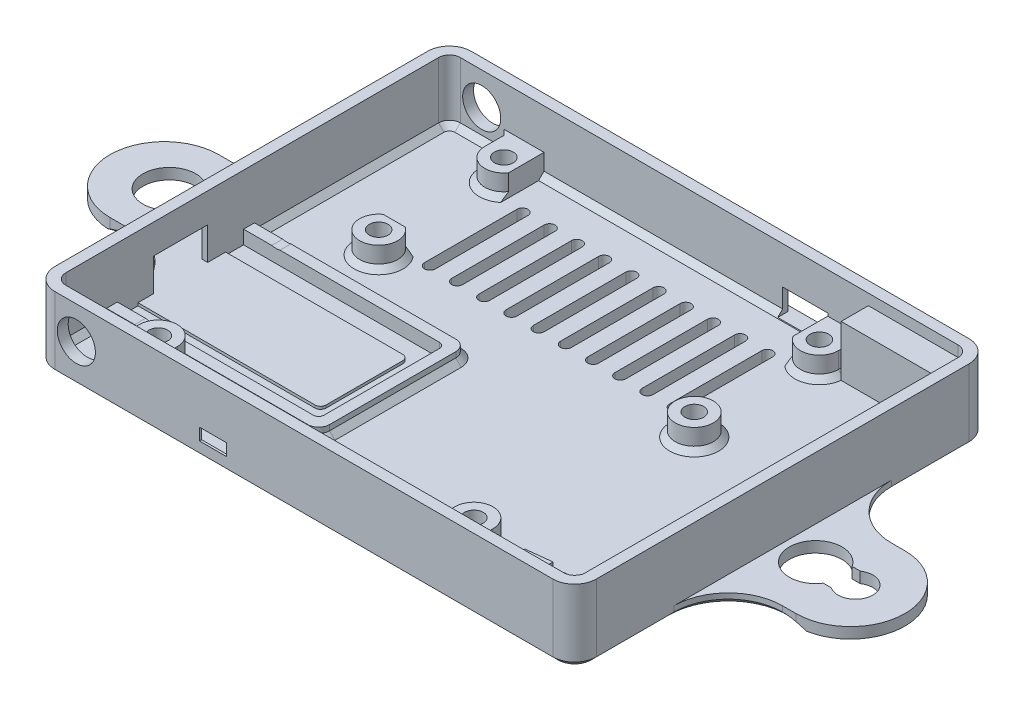
from build123d import *

# Parameters (mm, degrees)
BOSS_EXTRUDE1_DEPTH                               = 13.4
SKETCH23_W                                        = 25.165964968
SKETCH23_H                                        = 40
SKETCH23_W_2                                      = 26.273202002
CUT_EXTRUDE9_DEPTH                                = 11.4
BOSS_EXTRUDE2_DEPTH                               = 2
SKETCH4_R                                         = 3.5
BOSS_EXTRUDE3_DEPTH                               = 4
CSK_FOR_4_FLAT_HEAD_SOCKET_CAP_SCREW1_D           = 3.4544
CSK_FOR_4_FLAT_HEAD_SOCKET_CAP_SCREW1_CSINK_D     = 6.7237356
CSK_FOR_4_FLAT_HEAD_SOCKET_CAP_SCREW1_CSINK_ANGLE = 82
CUT_EXTRUDE1_REACH                                = 130.803
SKETCH7_W                                         = 8.3
SKETCH7_H                                         = 4.4
BOSS_EXTRUDE5_DEPTH                               = 2
FILLET1_R                                         = 1
FILLET2_R                                         = 1
FILLET3_R                                         = 2
CUT_EXTRUDE4_REACH                                = 136.745
SKETCH16_W                                        = 10
SKETCH16_H                                        = 6
BOSS_EXTRUDE4_DEPTH                               = 7.4
CSK_FOR_4_FLAT_HEAD_SOCKET_CAP_SCREW2_D           = 3.4544
CSK_FOR_4_FLAT_HEAD_SOCKET_CAP_SCREW2_CSINK_D     = 6.7237356
CSK_FOR_4_FLAT_HEAD_SOCKET_CAP_SCREW2_CSINK_ANGLE = 82
CHAMFER1_SIZE                                     = 1
CHAMFER2_SIZE                                     = 1
CHAMFER3_SIZE                                     = 1
CHAMFER4_SIZE                                     = 1
CUT_EXTRUDE2_REACH                                = 121.677
SKETCH14_R                                        = 3.5
CUT_EXTRUDE3_DEPTH                                = 129.80292872
BOSS_EXTRUDE6_DEPTH                               = 11.4
CUT_EXTRUDE5_START                                = -2
CUT_EXTRUDE5_DEPTH                                = 2
CUT_EXTRUDE6_DEPTH                                = 2
CUT_EXTRUDE6_DEPTH_BACK                           = 1.6
SKETCH19_W                                        = 11.8
SKETCH19_H                                        = 4
SKETCH20_W                                        = 5
SKETCH20_H                                        = 2.2
CUT_EXTRUDE7_DEPTH                                = 129.565759232
CUT_EXTRUDE8_DEPTH                                = 0.5
BOSS_EXTRUDE7_DEPTH                               = 2
SKETCH24_W                                        = 18.5
SKETCH24_H                                        = 9.4
BOSS_EXTRUDE8_DEPTH                               = 5


with BuildPart() as part:
    # Sketch2 → Boss-Extrude1 (new body)
    with BuildSketch(Plane(origin=(0, 0, 0), x_dir=(1, 0, 0), z_dir=(0, 1, 0))):
        with BuildLine():
            ThreePointArc((30.883018236, -31.622145181), (23.811950424, -34.551077369), (20.883018236, -41.622145181))
            Line((20.883018236, -41.622145181), (20.883018236, -55.872145181))
            ThreePointArc((20.883018236, -55.872145181), (19.711445361, -58.700572306), (16.883018236, -59.872145181))
            Line((16.883018236, -59.872145181), (-74.616981764, -59.872145181))
            ThreePointArc((-74.616981764, -59.872145181), (-77.445408889, -58.700572306), (-78.616981764, -55.872145181))
            Line((-78.616981764, -55.872145181), (-78.616981764, -41.622145181))
            ThreePointArc((-78.616981764, -41.622145181), (-81.545913952, -34.551077369), (-88.616981764, -31.622145181))
            Line((-88.616981764, -31.622145181), (-92.753999563, -31.622145181))
            ThreePointArc((-92.753999563, -31.622145181), (-102.753999563, -21.622145181), (-92.753999563, -11.622145181))
            Line((-92.753999563, -11.622145181), (-88.616981764, -11.622145181))
            ThreePointArc((-88.616981764, -11.622145181), (-81.545913952, -8.693212993), (-78.616981764, -1.622145181))
            Line((-78.616981764, -1.622145181), (-78.616981764, 12.627854819))
            ThreePointArc((-78.616981764, 12.627854819), (-77.445408889, 15.456281944), (-74.616981764, 16.627854819))
            Line((-74.616981764, 16.627854819), (16.883018236, 16.627854819))
            ThreePointArc((16.883018236, 16.627854819), (19.711445361, 15.456281944), (20.883018236, 12.627854819))
            Line((20.883018236, 12.627854819), (20.883018236, -1.622145181))
            ThreePointArc((20.883018236, -1.622145181), (23.811950424, -8.693212993), (30.883018236, -11.622145181))
            Line((30.883018236, -11.622145181), (33.349251591, -11.622145181))
            ThreePointArc((33.349251591, -11.622145181), (43.349251591, -21.622145181), (33.349251591, -31.622145181))
            Line((33.349251591, -31.622145181), (30.883018236, -31.622145181))
        make_face()
        with BuildLine():
            ThreePointArc((-87.799481249, -18.964457529), (-96.687349183, -21.622145181), (-87.799481249, -24.279832834))
            Line((-87.799481249, -24.279832834), (-86.319129664, -24.279832834))
            ThreePointArc((-86.319129664, -24.279832834), (-81.336800755, -21.622145181), (-86.319129664, -18.964457529))
            Line((-86.319129664, -18.964457529), (-87.799481249, -18.964457529))
        make_face(mode=Mode.SUBTRACT)
        with BuildLine():
            ThreePointArc((32.474863499, -24.279832834), (37.457192409, -21.622145181), (32.474863499, -18.964457529))
            Line((32.474863499, -18.964457529), (30.994511914, -18.964457529))
            ThreePointArc((30.994511914, -18.964457529), (22.10664398, -21.622145181), (30.994511914, -24.279832834))
            Line((30.994511914, -24.279832834), (32.474863499, -24.279832834))
        make_face(mode=Mode.SUBTRACT)
        with BuildLine():
            ThreePointArc((-74.616981764, 14.627854819), (-76.031195326, 14.042068381), (-76.616981764, 12.627854819))
            Line((-76.616981764, 12.627854819), (-76.616981764, -55.872145181))
            ThreePointArc((-76.616981764, -55.872145181), (-76.031195326, -57.286358744), (-74.616981764, -57.872145181))
            Line((-74.616981764, -57.872145181), (16.883018236, -57.872145181))
            ThreePointArc((16.883018236, -57.872145181), (18.297231798, -57.286358744), (18.883018236, -55.872145181))
            Line((18.883018236, -55.872145181), (18.883018236, 12.627854819))
            ThreePointArc((18.883018236, 12.627854819), (18.297231798, 14.042068381), (16.883018236, 14.627854819))
            Line((16.883018236, 14.627854819), (-74.616981764, 14.627854819))
        make_face(mode=Mode.SUBTRACT)
    extrude(amount=BOSS_EXTRUDE1_DEPTH)

    # Sketch23 → Cut-Extrude9 (cut)
    with BuildSketch(Plane(origin=(0, 13.4, 0), x_dir=(1, 0, 0), z_dir=(0, 1, 0))):
        with Locations((-91.199964248, -21.622145181)):
            Rectangle(SKETCH23_W, SKETCH23_H)
        with Locations((34.019619237, -21.622145181)):
            Rectangle(SKETCH23_W_2, SKETCH23_H)
    extrude(amount=-CUT_EXTRUDE9_DEPTH, mode=Mode.SUBTRACT)

    # Sketch2<3> → Boss-Extrude2 (add)
    with BuildSketch(Plane(origin=(0, 0, 0), x_dir=(1, 0, 0), z_dir=(0, 1, 0))):
        with BuildLine():
            Line((-74.616981764, 14.627854819), (16.883018236, 14.627854819))
            ThreePointArc((16.883018236, 14.627854819), (18.297231798, 14.042068381), (18.883018236, 12.627854819))
            Line((18.883018236, 12.627854819), (18.883018236, -55.872145181))
            ThreePointArc((18.883018236, -55.872145181), (18.297231798, -57.286358744), (16.883018236, -57.872145181))
            Line((16.883018236, -57.872145181), (-74.616981764, -57.872145181))
            ThreePointArc((-74.616981764, -57.872145181), (-76.031195326, -57.286358744), (-76.616981764, -55.872145181))
            Line((-76.616981764, -55.872145181), (-76.616981764, 12.627854819))
            ThreePointArc((-76.616981764, 12.627854819), (-76.031195326, 14.042068381), (-74.616981764, 14.627854819))
        make_face()
    extrude(amount=BOSS_EXTRUDE2_DEPTH)

    # Sketch4 → Boss-Extrude3 (add)
    with BuildSketch(Plane(origin=(0, 2, 0), x_dir=(1, 0, 0), z_dir=(0, 1, 0))):
        with Locations(Location((-4.116981764, -12.872145181, 0), (0, 0, 270))):
            Circle(SKETCH4_R)
        with BuildLine():
            Line((-59.234341769, 14.627854819), (-59.234341769, 8.142814098))
            ThreePointArc((-59.234341769, 8.142814098), (-63.156395065, 6.785756677), (-65.616981764, 10.127854819))
            Line((-65.616981764, 10.127854819), (-65.616981764, 14.627854819))
            Line((-65.616981764, 14.627854819), (-59.234341769, 14.627854819))
        make_face()
        with BuildLine():
            Line((-7.082532008, 14.627854819), (-0.616981764, 14.627854819))
            Line((-0.616981764, 14.627854819), (-0.616981764, 10.127854819))
            ThreePointArc((-0.616981764, 10.127854819), (-3.149879354, 6.764119852), (-7.082532008, 8.268954136))
            Line((-7.082532008, 8.268954136), (-7.082532008, 14.627854819))
        make_face()
        with BuildLine():
            Line((-64.139653984, -10.015784368), (-60.094309544, -10.015784368))
            ThreePointArc((-60.094309544, -10.015784368), (-62.116981764, -16.372145181), (-64.139653984, -10.015784368))
        make_face()
    extrude(amount=BOSS_EXTRUDE3_DEPTH)

    # CSK for #4 Flat Head Socket Cap Screw1 (through all)
    with Locations(Plane(origin=(0, 0, 0), x_dir=(-1, 0, 0), z_dir=(0, -1, 0))):
        with Locations((4.116981764, 10.127854819), (62.116981764, 10.127854819), (4.116981764, -12.872145181), (62.116981764, -12.872145181)):
            CounterSinkHole(CSK_FOR_4_FLAT_HEAD_SOCKET_CAP_SCREW1_D / 2, CSK_FOR_4_FLAT_HEAD_SOCKET_CAP_SCREW1_CSINK_D / 2, counter_sink_angle=CSK_FOR_4_FLAT_HEAD_SOCKET_CAP_SCREW1_CSINK_ANGLE)

    # Sketch7 → Cut-Extrude1 (cut, up to next)
    with BuildSketch(Plane(origin=(0, 0, -16.627854819), x_dir=(-1, 0, 0), z_dir=(0, 0, -1)), mode=Mode.PRIVATE) as cut_extrude1_sk1:
        with Locations((11.232532008, 4.3)):
            Rectangle(SKETCH7_W, SKETCH7_H)
    cut_extrude1_tool1 = extrude(cut_extrude1_sk1.sketch, amount=-CUT_EXTRUDE1_REACH, mode=Mode.PRIVATE) & part.part
    add(cut_extrude1_tool1.solids().sort_by_distance((-11.232532, 4.3, -16.627855))[0], mode=Mode.SUBTRACT)

    # Sketch15 → Boss-Extrude5 (add)
    with BuildSketch(Plane(origin=(0, 2, 0), x_dir=(1, 0, 0), z_dir=(0, 1, 0))):
        Polygon((-76.616981764, -23.205263249), (-39.616981764, -23.205263249), (-39.616981764, -46.405263249), (-76.616981764, -46.405263249), (-76.616981764, -48.405263249), (-37.616981764, -48.405263249), (-37.616981764, -21.205263249), (-76.616981764, -21.205263249), align=None)
    extrude(amount=BOSS_EXTRUDE5_DEPTH)

    # Fillet1
    fillet1_edges = [part.edges().sort_by_distance(p)[0] for p in [
        (-39.616981764, 3, 23.205263249),
    ]]
    fillet(fillet1_edges, radius=FILLET1_R)

    # Fillet2
    fillet2_edges = [part.edges().sort_by_distance(p)[0] for p in [
        (-39.616981764, 3, 46.405263249),
    ]]
    fillet(fillet2_edges, radius=FILLET2_R)

    # Fillet3
    fillet3_edges = [part.edges().sort_by_distance(p)[0] for p in [
        (-37.616981764, 3, 48.405263249),
        (-37.616981764, 3, 21.205263249),
    ]]
    fillet(fillet3_edges, radius=FILLET3_R)

    # Sketch16 → Cut-Extrude4 (cut, up to next)
    with BuildSketch(Plane(origin=(-76.616981764, 0, 0), x_dir=(0, 0, -1), z_dir=(1, 0, 0)), mode=Mode.PRIVATE) as cut_extrude4_sk1:
        with Locations((-34.805263249, 5)):
            Rectangle(SKETCH16_W, SKETCH16_H)
    cut_extrude4_tool1 = extrude(cut_extrude4_sk1.sketch, amount=-CUT_EXTRUDE4_REACH, mode=Mode.PRIVATE) & part.part
    add(cut_extrude4_tool1.solids().sort_by_distance((-76.616982, 5, 34.805263))[0], mode=Mode.SUBTRACT)

    # Sketch9 → Boss-Extrude4 (add)
    with BuildSketch(Plane(origin=(0, 2, 0), x_dir=(1, 0, 0), z_dir=(0, 1, 0))):
        with BuildLine():
            Line((-65.616981764, -57.872145181), (-58.616981764, -57.872145181))
            Line((-58.616981764, -57.872145181), (-58.616981764, -53.372145181))
            ThreePointArc((-58.616981764, -53.372145181), (-62.116981764, -49.872145181), (-65.616981764, -53.372145181))
            Line((-65.616981764, -53.372145181), (-65.616981764, -57.872145181))
        make_face()
        with BuildLine():
            Line((-7.616981764, -53.372145181), (-7.616981764, -57.872145181))
            Line((-7.616981764, -57.872145181), (-0.616981764, -57.872145181))
            Line((-0.616981764, -57.872145181), (-0.616981764, -53.372145181))
            ThreePointArc((-0.616981764, -53.372145181), (-4.116981764, -49.872145181), (-7.616981764, -53.372145181))
        make_face()
    extrude(amount=BOSS_EXTRUDE4_DEPTH)

    # CSK for #4 Flat Head Socket Cap Screw2 (through all)
    with Locations(Plane(origin=(0, 0, 0), x_dir=(-1, 0, 0), z_dir=(0, -1, 0))):
        with Locations((4.116981764, -53.372145181), (62.116981764, -53.372145181)):
            CounterSinkHole(CSK_FOR_4_FLAT_HEAD_SOCKET_CAP_SCREW2_D / 2, CSK_FOR_4_FLAT_HEAD_SOCKET_CAP_SCREW2_CSINK_D / 2, counter_sink_angle=CSK_FOR_4_FLAT_HEAD_SOCKET_CAP_SCREW2_CSINK_ANGLE)

    # Chamfer1
    chamfer1_edges = [part.edges().sort_by_distance(p)[0] for p in [
        (-0.616981764, 4, -14.627854819),
        (-65.616981764, 4, -14.627854819),
        (-7.616981764, 5.7, 57.872145181),
        (-0.616981764, 5.7, 57.872145181),
        (-65.616981764, 5.7, 57.872145181),
        (-58.616981764, 5.7, 57.872145181),
    ]]
    chamfer(chamfer1_edges, length=CHAMFER1_SIZE)

    # Chamfer2
    # the kernel refuses this chamfer: 1 mm, written as the material it adds along each edge
    with BuildSketch(Plane(origin=(-62.116981764, 2, 12.872145181), x_dir=(0.003141587485879022, 0, -0.9999950652018582), z_dir=(-0.9999950652018582, 0, -0.003141587485879022))) as chamfer2_piece_1_section:
        Polygon((3.5, -CHAMFER2_SIZE), (3.5 + CHAMFER2_SIZE, 0), (3.5, 0), align=None)
    chamfer2_piece_1 = revolve(axis=Axis((-62.116981764, 2, 12.872145181), (0, -1, 0)), revolution_arc=359.64, mode=Mode.PRIVATE)
    chamfer2_piece_1 = split(chamfer2_piece_1, bisect_by=Plane(origin=(-62.116981764, 2, 10.015784368), z_dir=(0, 0, 1)), keep=Keep.TOP, mode=Mode.PRIVATE)
    add(chamfer2_piece_1)
    with BuildSketch(Plane(origin=(-65.616981764, 2, -10.127854819), x_dir=(-1, 0, 0), z_dir=(0, 0, -1)), Plane(origin=(-0.616981764, 2, -16.199537807), x_dir=(1, 0, 0), z_dir=(0, 0, 1))) as chamfer2_piece_2:
        Polygon((CHAMFER2_SIZE, 0), (0, CHAMFER2_SIZE), (0, 0), align=None)
    extrude(amount=6.071682988)
    with BuildSketch(Plane(origin=(-62.116981764, 2, -10.127854819), x_dir=(0.9912359001966069, 0, -0.13210370987001943), z_dir=(-0.13210370987001943, 0, -0.9912359001966069))) as chamfer2_piece_3_section:
        Polygon((3.5 + CHAMFER2_SIZE, 0), (3.5, -CHAMFER2_SIZE), (3.5, 0), align=None)
    chamfer2_piece_3 = revolve(axis=Axis((-62.116981764, 2, -10.127854819), (0, -1, 0)), revolution_arc=187.591174622, mode=Mode.PRIVATE)
    chamfer2_piece_3 = split(chamfer2_piece_3, bisect_by=Plane(origin=(-59.234341769, 2, -10.127854819), z_dir=(-1, 0, 0)), keep=Keep.TOP, mode=Mode.PRIVATE)
    add(chamfer2_piece_3)
    with BuildSketch(Plane(origin=(18.883018236, 2, -12.627854819), x_dir=(-1, 0, 0), z_dir=(0, 0, 1))) as chamfer2_piece_4:
        Polygon((CHAMFER2_SIZE, 0), (0, -CHAMFER2_SIZE), (0, 0), align=None)
    extrude(amount=68.5)
    with BuildSketch(Plane(origin=(-74.616981764, 2, -14.627854819), x_dir=(0, 0, 1), z_dir=(1, 0, 0)), Plane(origin=(-64.045298776, 2, 57.872145181), x_dir=(0, 0, -1), z_dir=(-1, 0, 0))) as chamfer2_piece_5:
        Polygon((CHAMFER2_SIZE, 0), (0, -CHAMFER2_SIZE), (0, 0), align=None)
    extrude(amount=10.571682988)
    with BuildSketch(Plane(origin=(-74.616981764, 2, -12.627854819), x_dir=(-1, 0, 0), z_dir=(0, 0, 1))) as chamfer2_piece_6:
        Polygon((2 - CHAMFER2_SIZE, 0), (2, -CHAMFER2_SIZE), (2, 0), align=None)
    revolve(axis=Axis((-74.616981764, 2, -12.627854819), (0, -1, 0)), revolution_arc=90)
    with BuildSketch(Plane(origin=(-76.616981764, 2, 23.776946237), x_dir=(1, 0, 0), z_dir=(0, 0, -1))) as chamfer2_piece_7_section:
        Polygon((CHAMFER2_SIZE, 0), (0, -CHAMFER2_SIZE), (0, 0), align=None)
    chamfer2_piece_7 = extrude(amount=36.404801056, mode=Mode.PRIVATE)
    chamfer2_piece_7 = split(chamfer2_piece_7, bisect_by=Plane(origin=(-76.616981764, 2, 23.205263249), z_dir=(0, 0, -1)), keep=Keep.TOP, mode=Mode.PRIVATE)
    add(chamfer2_piece_7)
    with BuildSketch(Plane(origin=(-61.806024757, 2, -14.627854819), x_dir=(0, 0, 1), z_dir=(1, 0, 0))) as chamfer2_piece_8_section:
        Polygon((CHAMFER2_SIZE, 0), (0, -CHAMFER2_SIZE), (0, 0), align=None)
    chamfer2_piece_8 = extrude(amount=57.295175737, mode=Mode.PRIVATE)
    chamfer2_piece_8 = split(chamfer2_piece_8, bisect_by=Plane(origin=(-61.806024757, 2.1, -14.627854819), z_dir=(0, -1, 0)), keep=Keep.TOP, mode=Mode.PRIVATE)
    add(chamfer2_piece_8)
    with BuildSketch(Plane(origin=(-61.806024757, 2, -14.627854819), x_dir=(0, 0, 1), z_dir=(1, 0, 0))) as chamfer2_piece_9_section:
        Polygon((CHAMFER2_SIZE, 0), (0, -CHAMFER2_SIZE), (0, 0), align=None)
    chamfer2_piece_9 = extrude(amount=57.295175737, mode=Mode.PRIVATE)
    chamfer2_piece_9 = split(chamfer2_piece_9, bisect_by=Plane(origin=(-15.382532008, 2, -14.627854819), z_dir=(-1, 0, 0)), keep=Keep.TOP, mode=Mode.PRIVATE)
    add(chamfer2_piece_9)
    with BuildSketch(Plane(origin=(-74.616981764, 2, 55.872145181), x_dir=(0, 0, 1), z_dir=(1, 0, 0))) as chamfer2_piece_10:
        Polygon((2 - CHAMFER2_SIZE, 0), (2, -CHAMFER2_SIZE), (2, 0), align=None)
    revolve(axis=Axis((-74.616981764, 2, 55.872145181), (0, -1, 0)), revolution_arc=90)
    with BuildSketch(Plane(origin=(-65.616981764, 2, 53.372145181), x_dir=(-1, 0, 0), z_dir=(0, 0, 1)), Plane(origin=(-58.616981764, 2, 59.443828169), x_dir=(1, 0, 0), z_dir=(0, 0, -1)), Plane(origin=(-0.616981764, 2, 59.443828169), x_dir=(1, 0, 0), z_dir=(0, 0, -1)), Plane(origin=(-7.616981764, 2, 53.372145181), x_dir=(-1, 0, 0), z_dir=(0, 0, 1))) as chamfer2_piece_11:
        Polygon((CHAMFER2_SIZE, 0), (0, -CHAMFER2_SIZE), (0, 0), align=None)
    extrude(amount=6.071682988)
    with BuildSketch(Plane(origin=(-62.116981764, 2, 53.372145181), x_dir=(1, 0, 0), z_dir=(0, 0, 1))) as chamfer2_piece_12:
        Polygon((3.5 + CHAMFER2_SIZE, 0), (3.5, CHAMFER2_SIZE), (3.5, 0), align=None)
    revolve(axis=Axis((-62.116981764, 2, 53.372145181), (0, 1, 0)), revolution_arc=180)
    with BuildSketch(Plane(origin=(16.883018236, 2, 57.872145181), x_dir=(0, 0, -1), z_dir=(-1, 0, 0)), Plane(origin=(-2.188664752, 2, -14.627854819), x_dir=(0, 0, 1), z_dir=(1, 0, 0))) as chamfer2_piece_13:
        Polygon((CHAMFER2_SIZE, 0), (0, -CHAMFER2_SIZE), (0, 0), align=None)
    extrude(amount=19.071682988)
    with BuildSketch(Plane(origin=(16.883018236, 2, 55.872145181), x_dir=(1, 0, 0), z_dir=(0, 0, -1))) as chamfer2_piece_14:
        Polygon((2 - CHAMFER2_SIZE, 0), (2, -CHAMFER2_SIZE), (2, 0), align=None)
    revolve(axis=Axis((16.883018236, 2, 55.872145181), (0, -1, 0)), revolution_arc=90)
    with BuildSketch(Plane(origin=(-6.045298776, 2, 57.872145181), x_dir=(0, 0, -1), z_dir=(-1, 0, 0))) as chamfer2_piece_15:
        Polygon((CHAMFER2_SIZE, 0), (0, -CHAMFER2_SIZE), (0, 0), align=None)
    extrude(amount=54.143365976)
    with BuildSketch(Plane(origin=(16.883018236, 2, -12.627854819), x_dir=(0, 0, -1), z_dir=(-1, 0, 0))) as chamfer2_piece_16:
        Polygon((2 - CHAMFER2_SIZE, 0), (2, -CHAMFER2_SIZE), (2, 0), align=None)
    revolve(axis=Axis((16.883018236, 2, -12.627854819), (0, -1, 0)), revolution_arc=90)
    with BuildSketch(Plane(origin=(-4.116981764, 2, -10.127854819), x_dir=(1, 0, 0), z_dir=(0, 0, -1))) as chamfer2_piece_17_section:
        Polygon((3.5 + CHAMFER2_SIZE, 0), (3.5, -CHAMFER2_SIZE), (3.5, 0), align=None)
    chamfer2_piece_17 = revolve(axis=Axis((-4.116981764, 2, -10.127854819), (0, -1, 0)), revolution_arc=190.063940547, mode=Mode.PRIVATE)
    chamfer2_piece_17 = split(chamfer2_piece_17, bisect_by=Plane(origin=(-7.082532008, 2, -10.127854819), z_dir=(1, 0, 0)), keep=Keep.TOP, mode=Mode.PRIVATE)
    add(chamfer2_piece_17)
    with BuildSketch(Plane(origin=(-4.116981764, 2, 53.372145181), x_dir=(1, 0, 0), z_dir=(0, 0, 1))) as chamfer2_piece_18:
        Polygon((3.5 + CHAMFER2_SIZE, 0), (3.5, CHAMFER2_SIZE), (3.5, 0), align=None)
    revolve(axis=Axis((-4.116981764, 2, 53.372145181), (0, 1, 0)), revolution_arc=180)
    with BuildSketch(Plane(origin=(-4.116981764, 2, 12.872145181), x_dir=(0, 0, 1), z_dir=(-1, 0, 0))) as chamfer2_piece_19:
        Polygon((3.5 + CHAMFER2_SIZE, 0), (3.5, CHAMFER2_SIZE), (3.5, 0), align=None)
    revolve(axis=Axis((-4.116981764, 2, 12.872145181), (0, 1, 0)))
    with BuildSketch(Plane(origin=(-79.188664752, 2, 48.405263249), x_dir=(0, 0, 1), z_dir=(1, 0, 0))) as chamfer2_piece_20_section:
        Polygon((CHAMFER2_SIZE, 0), (0, -CHAMFER2_SIZE), (0, 0), align=None)
    chamfer2_piece_20 = extrude(amount=39.571682988, mode=Mode.PRIVATE)
    chamfer2_piece_20 = split(chamfer2_piece_20, bisect_by=Plane(origin=(-78.616981764, 2, 48.405263249), z_dir=(1, 0, 0)), keep=Keep.TOP, mode=Mode.PRIVATE)
    add(chamfer2_piece_20)
    with BuildSketch(Plane(origin=(-39.616981764, 2, 21.205263249), x_dir=(0, 0, -1), z_dir=(-1, 0, 0))) as chamfer2_piece_21_section:
        Polygon((CHAMFER2_SIZE, 0), (0, -CHAMFER2_SIZE), (0, 0), align=None)
    chamfer2_piece_21 = extrude(amount=39.571682988, mode=Mode.PRIVATE)
    chamfer2_piece_21 = split(chamfer2_piece_21, bisect_by=Plane(origin=(-78.616981764, 2, 21.205263249), z_dir=(1, 0, 0)), keep=Keep.TOP, mode=Mode.PRIVATE)
    add(chamfer2_piece_21)
    with BuildSketch(Plane(origin=(-39.616981764, 2, 46.405263249), x_dir=(0, 0, 1), z_dir=(-1, 0, 0))) as chamfer2_piece_22:
        Polygon((2 + CHAMFER2_SIZE, 0), (2, CHAMFER2_SIZE), (2, 0), align=None)
    revolve(axis=Axis((-39.616981764, 2, 46.405263249), (0, 1, 0)), revolution_arc=90)
    with BuildSketch(Plane(origin=(-39.616981764, 2, 23.205263249), x_dir=(0, 0, -1), z_dir=(-1, 0, 0))) as chamfer2_piece_23:
        Polygon((2 + CHAMFER2_SIZE, 0), (2, -CHAMFER2_SIZE), (2, 0), align=None)
    revolve(axis=Axis((-39.616981764, 2, 23.205263249), (0, -1, 0)), revolution_arc=90)
    with BuildSketch(Plane(origin=(-37.616981764, 2, 46.405263249), x_dir=(1, 0, 0), z_dir=(0, 0, -1))) as chamfer2_piece_24:
        Polygon((CHAMFER2_SIZE, 0), (0, -CHAMFER2_SIZE), (0, 0), align=None)
    extrude(amount=23.2)
    with BuildSketch(Plane(origin=(-76.616981764, 2, 55.872145181), x_dir=(1, 0, 0), z_dir=(0, 0, -1))) as chamfer2_piece_25:
        Polygon((CHAMFER2_SIZE, 0), (0, -CHAMFER2_SIZE), (0, 0), align=None)
    extrude(amount=7.466881932)

    # Chamfer3
    # the kernel refuses this chamfer: 1 mm, written as the material it takes off along each edge
    with BuildSketch(Plane(origin=(20.883018236, 0, 41.622145181), x_dir=(0, 1, 0), z_dir=(0, 0, 1)), Plane(origin=(-78.616981764, 0, 55.872145181), x_dir=(0, 1, 0), z_dir=(0, 0, -1)), Plane(origin=(-78.616981764, 0, 1.622145181), x_dir=(0, 1, 0), z_dir=(0, 0, -1)), Plane(origin=(20.883018236, 0, -12.627854819), x_dir=(0, 1, 0), z_dir=(0, 0, 1))) as chamfer3_piece_1:
        Polygon((CHAMFER3_SIZE, 0), (0, CHAMFER3_SIZE), (0, 0), align=None)
    extrude(amount=14.25, mode=Mode.SUBTRACT)
    with BuildSketch(Plane(origin=(16.883018236, 0, 55.872145181), x_dir=(1, 0, 0), z_dir=(0, 0, -1))) as chamfer3_piece_2:
        Polygon((4, -CHAMFER3_SIZE), (4 - CHAMFER3_SIZE, 0), (4, 0), align=None)
    revolve(axis=Axis((16.883018236, 0, 55.872145181), (0, -1, 0)), revolution_arc=90, mode=Mode.SUBTRACT)
    with BuildSketch(Plane(origin=(16.883018236, 0, 59.872145181), x_dir=(0, 1, 0), z_dir=(-1, 0, 0)), Plane(origin=(-74.616981764, 0, -16.627854819), x_dir=(0, 1, 0), z_dir=(1, 0, 0))) as chamfer3_piece_3:
        Polygon((CHAMFER3_SIZE, 0), (0, CHAMFER3_SIZE), (0, 0), align=None)
    extrude(amount=91.5, mode=Mode.SUBTRACT)
    with BuildSketch(Plane(origin=(-74.616981764, 0, 55.872145181), x_dir=(0, 0, 1), z_dir=(1, 0, 0))) as chamfer3_piece_4:
        Polygon((4, -CHAMFER3_SIZE), (4 - CHAMFER3_SIZE, 0), (4, 0), align=None)
    revolve(axis=Axis((-74.616981764, 0, 55.872145181), (0, -1, 0)), revolution_arc=90, mode=Mode.SUBTRACT)
    with BuildSketch(Plane(origin=(-88.616981764, 0, 41.622145181), x_dir=(1, 0, 0), z_dir=(0, 0, 1))) as chamfer3_piece_5:
        Polygon((10, CHAMFER3_SIZE), (10 + CHAMFER3_SIZE, 0), (10, 0), align=None)
    revolve(axis=Axis((-88.616981764, 0, 41.622145181), (0, 1, 0)), revolution_arc=115.058981203, mode=Mode.SUBTRACT)
    with BuildSketch(Plane(origin=(-88.616981764, 0, 1.622145181), x_dir=(-0.42355100555257846, 0, 0.9058722568306193), z_dir=(-0.9058722568306193, 0, -0.42355100555257846))) as chamfer3_piece_6:
        Polygon((10, CHAMFER3_SIZE), (10 + CHAMFER3_SIZE, 0), (10, 0), align=None)
    revolve(axis=Axis((-88.616981764, 0, 1.622145181), (0, 1, 0)), revolution_arc=115.058981203, mode=Mode.SUBTRACT)
    with BuildSketch(Plane(origin=(-74.616981764, 0, -12.627854819), x_dir=(-1, 0, 0), z_dir=(0, 0, 1))) as chamfer3_piece_7:
        Polygon((4, -CHAMFER3_SIZE), (4 - CHAMFER3_SIZE, 0), (4, 0), align=None)
    revolve(axis=Axis((-74.616981764, 0, -12.627854819), (0, -1, 0)), revolution_arc=90, mode=Mode.SUBTRACT)
    with BuildSketch(Plane(origin=(16.883018236, 0, -12.627854819), x_dir=(0, 0, -1), z_dir=(-1, 0, 0))) as chamfer3_piece_8:
        Polygon((4, -CHAMFER3_SIZE), (4 - CHAMFER3_SIZE, 0), (4, 0), align=None)
    revolve(axis=Axis((16.883018236, 0, -12.627854819), (0, -1, 0)), revolution_arc=90, mode=Mode.SUBTRACT)
    with BuildSketch(Plane(origin=(30.883018236, 0, 1.622145181), x_dir=(-1, 0, 0), z_dir=(0, 0, -1))) as chamfer3_piece_9:
        Polygon((10, CHAMFER3_SIZE), (10 + CHAMFER3_SIZE, 0), (10, 0), align=None)
    revolve(axis=Axis((30.883018236, 0, 1.622145181), (0, 1, 0)), revolution_arc=115.058981203, mode=Mode.SUBTRACT)
    with BuildSketch(Plane(origin=(30.883018236, 0, 41.622145181), x_dir=(0.42355100555257597, 0, -0.9058722568306204), z_dir=(0.9058722568306204, 0, 0.42355100555257597))) as chamfer3_piece_10:
        Polygon((10, CHAMFER3_SIZE), (10 + CHAMFER3_SIZE, 0), (10, 0), align=None)
    revolve(axis=Axis((30.883018236, 0, 41.622145181), (0, 1, 0)), revolution_arc=115.058981203, mode=Mode.SUBTRACT)

    # Chamfer4
    chamfer4_edges = [part.edges().sort_by_distance(p)[0] for p in [
        (-7.082532008, 4.3, -16.627854819),
        (-15.382532008, 4.3, -16.627854819),
        (-78.616981764, 5, 39.805263249),
        (-78.616981764, 5, 29.805263249),
    ]]
    chamfer(chamfer4_edges, length=CHAMFER4_SIZE)

    # Sketch12 → Cut-Extrude2 (cut, up to next)
    with BuildSketch(Plane.XZ, mode=Mode.PRIVATE) as cut_extrude2_sk1:
        with BuildLine():
            Line((-54.660539895, 9.911346827), (-54.660539895, -7.088653173))
            ThreePointArc((-54.660539895, -7.088653173), (-55.660539895, -8.088653173), (-56.660539895, -7.088653173))
            Line((-56.660539895, -7.088653173), (-56.660539895, 9.911346827))
            ThreePointArc((-56.660539895, 9.911346827), (-55.660539895, 10.911346827), (-54.660539895, 9.911346827))
        make_face()
    cut_extrude2_tool1 = extrude(cut_extrude2_sk1.sketch, amount=-CUT_EXTRUDE2_REACH, mode=Mode.PRIVATE) & part.part
    # Sketch12 → Cut-Extrude2 (cut, up to next)
    with BuildSketch(Plane.XZ, mode=Mode.PRIVATE) as cut_extrude2_sk2:
        with BuildLine():
            Line((-49.660539895, 9.911346827), (-49.660539895, -7.088653173))
            ThreePointArc((-49.660539895, -7.088653173), (-50.660539895, -8.088653173), (-51.660539895, -7.088653173))
            Line((-51.660539895, -7.088653173), (-51.660539895, 9.911346827))
            ThreePointArc((-51.660539895, 9.911346827), (-50.660539895, 10.911346827), (-49.660539895, 9.911346827))
        make_face()
    cut_extrude2_tool2 = extrude(cut_extrude2_sk2.sketch, amount=-CUT_EXTRUDE2_REACH, mode=Mode.PRIVATE) & part.part
    # Sketch12 → Cut-Extrude2 (cut, up to next)
    with BuildSketch(Plane.XZ, mode=Mode.PRIVATE) as cut_extrude2_sk3:
        with BuildLine():
            Line((-44.660539895, 9.911346827), (-44.660539895, -7.088653173))
            ThreePointArc((-44.660539895, -7.088653173), (-45.660539895, -8.088653173), (-46.660539895, -7.088653173))
            Line((-46.660539895, -7.088653173), (-46.660539895, 9.911346827))
            ThreePointArc((-46.660539895, 9.911346827), (-45.660539895, 10.911346827), (-44.660539895, 9.911346827))
        make_face()
    cut_extrude2_tool3 = extrude(cut_extrude2_sk3.sketch, amount=-CUT_EXTRUDE2_REACH, mode=Mode.PRIVATE) & part.part
    # Sketch12 → Cut-Extrude2 (cut, up to next)
    with BuildSketch(Plane.XZ, mode=Mode.PRIVATE) as cut_extrude2_sk4:
        with BuildLine():
            Line((-39.660539895, 9.911346827), (-39.660539895, -7.088653173))
            ThreePointArc((-39.660539895, -7.088653173), (-40.660539895, -8.088653173), (-41.660539895, -7.088653173))
            Line((-41.660539895, -7.088653173), (-41.660539895, 9.911346827))
            ThreePointArc((-41.660539895, 9.911346827), (-40.660539895, 10.911346827), (-39.660539895, 9.911346827))
        make_face()
    cut_extrude2_tool4 = extrude(cut_extrude2_sk4.sketch, amount=-CUT_EXTRUDE2_REACH, mode=Mode.PRIVATE) & part.part
    # Sketch12 → Cut-Extrude2 (cut, up to next)
    with BuildSketch(Plane.XZ, mode=Mode.PRIVATE) as cut_extrude2_sk5:
        with BuildLine():
            Line((-34.660539895, 9.911346827), (-34.660539895, -7.088653173))
            ThreePointArc((-34.660539895, -7.088653173), (-35.660539895, -8.088653173), (-36.660539895, -7.088653173))
            Line((-36.660539895, -7.088653173), (-36.660539895, 9.911346827))
            ThreePointArc((-36.660539895, 9.911346827), (-35.660539895, 10.911346827), (-34.660539895, 9.911346827))
        make_face()
    cut_extrude2_tool5 = extrude(cut_extrude2_sk5.sketch, amount=-CUT_EXTRUDE2_REACH, mode=Mode.PRIVATE) & part.part
    # Sketch12 → Cut-Extrude2 (cut, up to next)
    with BuildSketch(Plane.XZ, mode=Mode.PRIVATE) as cut_extrude2_sk6:
        with BuildLine():
            Line((-29.660539895, 9.911346827), (-29.660539895, -7.088653173))
            ThreePointArc((-29.660539895, -7.088653173), (-30.660539895, -8.088653173), (-31.660539895, -7.088653173))
            Line((-31.660539895, -7.088653173), (-31.660539895, 9.911346827))
            ThreePointArc((-31.660539895, 9.911346827), (-30.660539895, 10.911346827), (-29.660539895, 9.911346827))
        make_face()
    cut_extrude2_tool6 = extrude(cut_extrude2_sk6.sketch, amount=-CUT_EXTRUDE2_REACH, mode=Mode.PRIVATE) & part.part
    # Sketch12 → Cut-Extrude2 (cut, up to next)
    with BuildSketch(Plane.XZ, mode=Mode.PRIVATE) as cut_extrude2_sk7:
        with BuildLine():
            Line((-24.660539895, 9.911346827), (-24.660539895, -7.088653173))
            ThreePointArc((-24.660539895, -7.088653173), (-25.660539895, -8.088653173), (-26.660539895, -7.088653173))
            Line((-26.660539895, -7.088653173), (-26.660539895, 9.911346827))
            ThreePointArc((-26.660539895, 9.911346827), (-25.660539895, 10.911346827), (-24.660539895, 9.911346827))
        make_face()
    cut_extrude2_tool7 = extrude(cut_extrude2_sk7.sketch, amount=-CUT_EXTRUDE2_REACH, mode=Mode.PRIVATE) & part.part
    # Sketch12 → Cut-Extrude2 (cut, up to next)
    with BuildSketch(Plane.XZ, mode=Mode.PRIVATE) as cut_extrude2_sk8:
        with BuildLine():
            Line((-19.660539895, 9.911346827), (-19.660539895, -7.088653173))
            ThreePointArc((-19.660539895, -7.088653173), (-20.660539895, -8.088653173), (-21.660539895, -7.088653173))
            Line((-21.660539895, -7.088653173), (-21.660539895, 9.911346827))
            ThreePointArc((-21.660539895, 9.911346827), (-20.660539895, 10.911346827), (-19.660539895, 9.911346827))
        make_face()
    cut_extrude2_tool8 = extrude(cut_extrude2_sk8.sketch, amount=-CUT_EXTRUDE2_REACH, mode=Mode.PRIVATE) & part.part
    # Sketch12 → Cut-Extrude2 (cut, up to next)
    with BuildSketch(Plane.XZ, mode=Mode.PRIVATE) as cut_extrude2_sk9:
        with BuildLine():
            Line((-14.660539895, 9.911346827), (-14.660539895, -7.088653173))
            ThreePointArc((-14.660539895, -7.088653173), (-15.660539895, -8.088653173), (-16.660539895, -7.088653173))
            Line((-16.660539895, -7.088653173), (-16.660539895, 9.911346827))
            ThreePointArc((-16.660539895, 9.911346827), (-15.660539895, 10.911346827), (-14.660539895, 9.911346827))
        make_face()
    cut_extrude2_tool9 = extrude(cut_extrude2_sk9.sketch, amount=-CUT_EXTRUDE2_REACH, mode=Mode.PRIVATE) & part.part
    # Sketch12 → Cut-Extrude2 (cut, up to next)
    with BuildSketch(Plane.XZ, mode=Mode.PRIVATE) as cut_extrude2_sk10:
        with BuildLine():
            Line((-9.660539895, 9.911346827), (-9.660539895, -7.088653173))
            ThreePointArc((-9.660539895, -7.088653173), (-10.660539895, -8.088653173), (-11.660539895, -7.088653173))
            Line((-11.660539895, -7.088653173), (-11.660539895, 9.911346827))
            ThreePointArc((-11.660539895, 9.911346827), (-10.660539895, 10.911346827), (-9.660539895, 9.911346827))
        make_face()
    cut_extrude2_tool10 = extrude(cut_extrude2_sk10.sketch, amount=-CUT_EXTRUDE2_REACH, mode=Mode.PRIVATE) & part.part
    add(cut_extrude2_tool1.solids().sort_by_distance((-55.66054, 0, 1.411347))[0], mode=Mode.SUBTRACT)
    add(cut_extrude2_tool2.solids().sort_by_distance((-50.66054, 0, 1.411347))[0], mode=Mode.SUBTRACT)
    add(cut_extrude2_tool3.solids().sort_by_distance((-45.66054, 0, 1.411347))[0], mode=Mode.SUBTRACT)
    add(cut_extrude2_tool4.solids().sort_by_distance((-40.66054, 0, 1.411347))[0], mode=Mode.SUBTRACT)
    add(cut_extrude2_tool5.solids().sort_by_distance((-35.66054, 0, 1.411347))[0], mode=Mode.SUBTRACT)
    add(cut_extrude2_tool6.solids().sort_by_distance((-30.66054, 0, 1.411347))[0], mode=Mode.SUBTRACT)
    add(cut_extrude2_tool7.solids().sort_by_distance((-25.66054, 0, 1.411347))[0], mode=Mode.SUBTRACT)
    add(cut_extrude2_tool8.solids().sort_by_distance((-20.66054, 0, 1.411347))[0], mode=Mode.SUBTRACT)
    add(cut_extrude2_tool9.solids().sort_by_distance((-15.66054, 0, 1.411347))[0], mode=Mode.SUBTRACT)
    add(cut_extrude2_tool10.solids().sort_by_distance((-10.66054, 0, 1.411347))[0], mode=Mode.SUBTRACT)

    # Sketch14 → Cut-Extrude3 (cut, through all)
    with BuildSketch(Plane.XY.offset(59.872145181)):
        with Locations((-70.687940053, 7.417383303)):
            Circle(SKETCH14_R)
    extrude(amount=-CUT_EXTRUDE3_DEPTH, mode=Mode.SUBTRACT)

    # Sketch17 → Boss-Extrude6 (add)
    with BuildSketch(Plane(origin=(0, 2, 0), x_dir=(1, 0, 0), z_dir=(0, 1, 0))):
        Polygon((11.433727818, -55.372145181), (18.883018236, -55.372145181), (18.883018236, -56.372145181), (-0.616981764, -56.372145181), (-0.616981764, -55.372145181), (6.230112718, -55.372145181), (6.230112718, -54.372145181), (11.433727818, -54.372145181), align=None)
    extrude(amount=BOSS_EXTRUDE6_DEPTH)

    # Sketch18 → Cut-Extrude5 (cut)
    with BuildSketch(Plane(origin=(0, 0, 54.372145181), x_dir=(-1, 0, 0), z_dir=(0, 0, -1)).offset(CUT_EXTRUDE5_START)):
        Polygon((-0.383018236, 6), (-18.883018236, 6), (-18.883018236, 3), (-17.74904364, 2), (-0.383018236, 2), (0.616981764, 3), (0.616981764, 6), align=None)
        Polygon((0.616981764, 9.4), (0.616981764, 13.4), (-18.883018236, 13.4), (-18.883018236, 11.4), align=None)
    extrude(amount=CUT_EXTRUDE5_DEPTH, mode=Mode.SUBTRACT)

    # Sketch19 → Cut-Extrude6 (cut, two sides: drawn at the far end of the back side and taken through both)
    with BuildSketch(Plane(origin=(-134.489126945, 0, 57.872145181), x_dir=(-1, 0, 0), z_dir=(0, 0, -1)).offset(-CUT_EXTRUDE6_DEPTH_BACK)):
        with Locations((-88.92858705, 4)):
            Rectangle(SKETCH19_W, SKETCH19_H)
    extrude(amount=CUT_EXTRUDE6_DEPTH + CUT_EXTRUDE6_DEPTH_BACK, mode=Mode.SUBTRACT)

    # Sketch20 → Cut-Extrude7 (cut, through all)
    with BuildSketch(Plane(origin=(0, 0, 59.472145181), x_dir=(-1, 0, 0), z_dir=(0, 0, -1))):
        with Locations((45.560539895, 4)):
            Rectangle(SKETCH20_W, SKETCH20_H)
    extrude(amount=-CUT_EXTRUDE7_DEPTH, mode=Mode.SUBTRACT)

    # Sketch21 → Cut-Extrude8 (cut)
    with BuildSketch(Plane(origin=(0, 2, 0), x_dir=(1, 0, 0), z_dir=(0, 1, 0))):
        with BuildLine():
            Line((-76.616981764, -26.505263249), (-44.056252102, -26.505263249))
            ThreePointArc((-44.056252102, -26.505263249), (-43.349145321, -26.798156468), (-43.056252102, -27.505263249))
            Line((-43.056252102, -27.505263249), (-43.056252102, -41.619369379))
            ThreePointArc((-43.056252102, -41.619369379), (-43.349145321, -42.326476161), (-44.056252102, -42.619369379))
            Line((-44.056252102, -42.619369379), (-76.616981764, -42.619369379))
            Line((-76.616981764, -42.619369379), (-76.616981764, -46.405263249))
            Line((-76.616981764, -46.405263249), (-40.616981764, -46.405263249))
            ThreePointArc((-40.616981764, -46.405263249), (-39.909874983, -46.11237003), (-39.616981764, -45.405263249))
            Line((-39.616981764, -45.405263249), (-39.616981764, -24.205263249))
            ThreePointArc((-39.616981764, -24.205263249), (-39.909874983, -23.498156468), (-40.616981764, -23.205263249))
            Line((-40.616981764, -23.205263249), (-76.616981764, -23.205263249))
            Line((-76.616981764, -23.205263249), (-76.616981764, -26.505263249))
        make_face()
    extrude(amount=-CUT_EXTRUDE8_DEPTH, mode=Mode.SUBTRACT)

    # Sketch22 → Boss-Extrude7 (add)
    with BuildSketch(Plane(origin=(0, 0, 57.872145181), x_dir=(-1, 0, 0), z_dir=(0, 0, -1))):
        Polygon((38.160539895, 7.5), (38.160539895, 2), (39.660539895, 2), (39.660539895, 6), (51.460539895, 6), (51.460539895, 2), (52.960539895, 2), (52.960539895, 7.5), align=None)
    extrude(amount=BOSS_EXTRUDE7_DEPTH)

    # Sketch24 → Boss-Extrude8 (add)
    with BuildSketch(Plane.XY.offset(-14.627854819)):
        with Locations((9.633018236, 6.7)):
            Rectangle(SKETCH24_W, SKETCH24_H)
    extrude(amount=BOSS_EXTRUDE8_DEPTH)


solid = part.part
